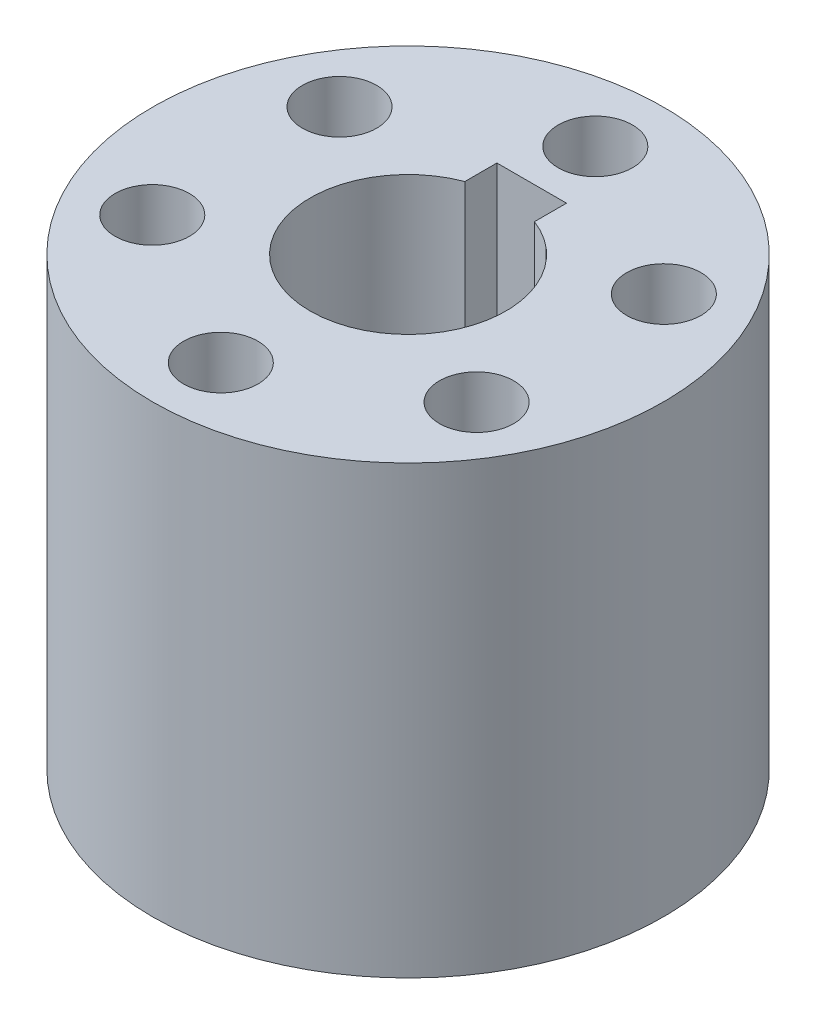
from build123d import *

# Parameters (mm, degrees)
SKETCH1_R           = 18.9
BOSS_EXTRUDE1_DEPTH = 33
SKETCH2_R           = 2.75
CUT_EXTRUDE1_DEPTH  = 91.4
CUT_EXTRUDE2_DEPTH  = 86


with BuildPart() as part:
    # Sketch1 → Boss-Extrude1 (new body)
    with BuildSketch(Plane(origin=(0, 0, 0), x_dir=(1, 0, 0), z_dir=(0, 1, 0))):
        Circle(SKETCH1_R)
    extrude(amount=BOSS_EXTRUDE1_DEPTH)

    # Sketch2 → Cut-Extrude1 (cut)
    with BuildSketch(Plane(origin=(0, 33, 0), x_dir=(1, 0, 0), z_dir=(0, 1, 0))):
        with Locations((0, 13.856406461)):
            Circle(SKETCH2_R)
        with Locations((-12, 6.92820323)):
            Circle(SKETCH2_R)
        with Locations((12, 6.92820323)):
            Circle(SKETCH2_R)
        with Locations((-12, -6.92820323)):
            Circle(SKETCH2_R)
        with Locations((12, -6.92820323)):
            Circle(SKETCH2_R)
        with Locations((0, -13.856406461)):
            Circle(SKETCH2_R)
    extrude(amount=-CUT_EXTRUDE1_DEPTH, mode=Mode.SUBTRACT)

    # Sketch3 → Cut-Extrude2 (cut)
    with BuildSketch(Plane(origin=(0, 33, 0), x_dir=(1, 0, 0), z_dir=(0, 1, 0))):
        with BuildLine():
            Line((2.575, 9.15), (-2.575, 9.15))
            Line((-2.575, 9.15), (-2.575, 6.777305881))
            ThreePointArc((-2.575, 6.777305881), (0, -7.25), (2.575, 6.777305881))
            Line((2.575, 6.777305881), (2.575, 9.15))
        make_face()
    extrude(amount=-CUT_EXTRUDE2_DEPTH, mode=Mode.SUBTRACT)


solid = part.part
